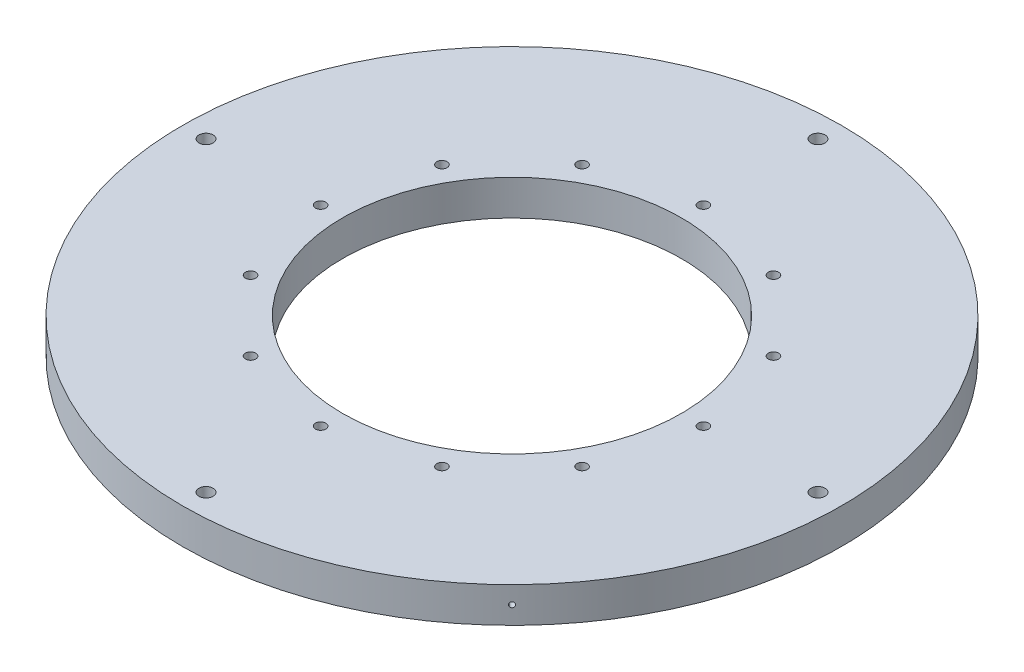
from build123d import *

# Parameters (mm, degrees)
SKETCH1_R           = 88.9
BOSS_EXTRUDE1_DEPTH = 9.525
SKETCH2_R           = 45.72
CUT_EXTRUDE1_DEPTH  = 12.7
SKETCH3_R           = 1.397
CUT_EXTRUDE2_DEPTH  = 12.7
CIRPATTERN1_COUNT   = 12
SKETCH4_R           = 1.905
CUT_EXTRUDE3_DEPTH  = 12.7
CIRPATTERN2_COUNT   = 4
SKETCH10_R          = 0.6985
CUT_EXTRUDE5_DEPTH  = 3.175
CIRPATTERN5_COUNT   = 4


with BuildPart() as part:
    # Sketch1 → Boss-Extrude1 (new body)
    with BuildSketch(Plane(origin=(0, 0, 0), x_dir=(1, 0, 0), z_dir=(0, 1, 0))):
        Circle(SKETCH1_R)
    extrude(amount=BOSS_EXTRUDE1_DEPTH)

    # Sketch2 → Cut-Extrude1 (cut)
    with BuildSketch(Plane(origin=(0, 9.525, 0), x_dir=(1, 0, 0), z_dir=(0, 1, 0))):
        Circle(SKETCH2_R)
    extrude(amount=-CUT_EXTRUDE1_DEPTH, mode=Mode.SUBTRACT)

    # Sketch3 → Cut-Extrude2 (cut)
    with BuildSketch(Plane(origin=(0, 9.525, 0), x_dir=(1, 0, 0), z_dir=(0, 1, 0))):
        with Locations((0, 51.6382)):
            Circle(SKETCH3_R)
    cut_extrude2 = extrude(amount=-CUT_EXTRUDE2_DEPTH, mode=Mode.SUBTRACT)

    # CirPattern1: Cut-Extrude2 ×12 about axis
    cirpattern1_axis = Axis((0, 9.525, 0), (0, 1, 0))
    for i in range(1, CIRPATTERN1_COUNT):
        add(cut_extrude2.rotate(cirpattern1_axis, i * 360 / CIRPATTERN1_COUNT), mode=Mode.SUBTRACT)

    # Sketch4 → Cut-Extrude3 (cut)
    with BuildSketch(Plane(origin=(0, 9.525, 0), x_dir=(1, 0, 0), z_dir=(0, 1, 0))):
        with Locations((0, 82.55)):
            Circle(SKETCH4_R)
    cut_extrude3 = extrude(amount=-CUT_EXTRUDE3_DEPTH, mode=Mode.SUBTRACT)

    # CirPattern2: Cut-Extrude3 ×4 about axis
    cirpattern2_axis = Axis((0, 9.525, 0), (0, 1, 0))
    for i in range(1, CIRPATTERN2_COUNT):
        add(cut_extrude3.rotate(cirpattern2_axis, i * 360 / CIRPATTERN2_COUNT), mode=Mode.SUBTRACT)

    # Sketch10 → Cut-Extrude5 (cut)
    with BuildSketch(Plane(origin=(-62.861792847, 0, -62.861792847), x_dir=(0, -1, 0), z_dir=(-0.7071067811865464, 0, -0.7071067811865488))):
        with Locations((-4.826, 0)):
            Circle(SKETCH10_R)
    cut_extrude5 = extrude(amount=-CUT_EXTRUDE5_DEPTH, mode=Mode.SUBTRACT)

    # CirPattern5: Cut-Extrude5 ×4 about axis
    cirpattern5_axis = Axis((0, 9.525, 0), (0, 1, 0))
    for i in range(1, CIRPATTERN5_COUNT):
        add(cut_extrude5.rotate(cirpattern5_axis, i * 360 / CIRPATTERN5_COUNT), mode=Mode.SUBTRACT)


solid = part.part
